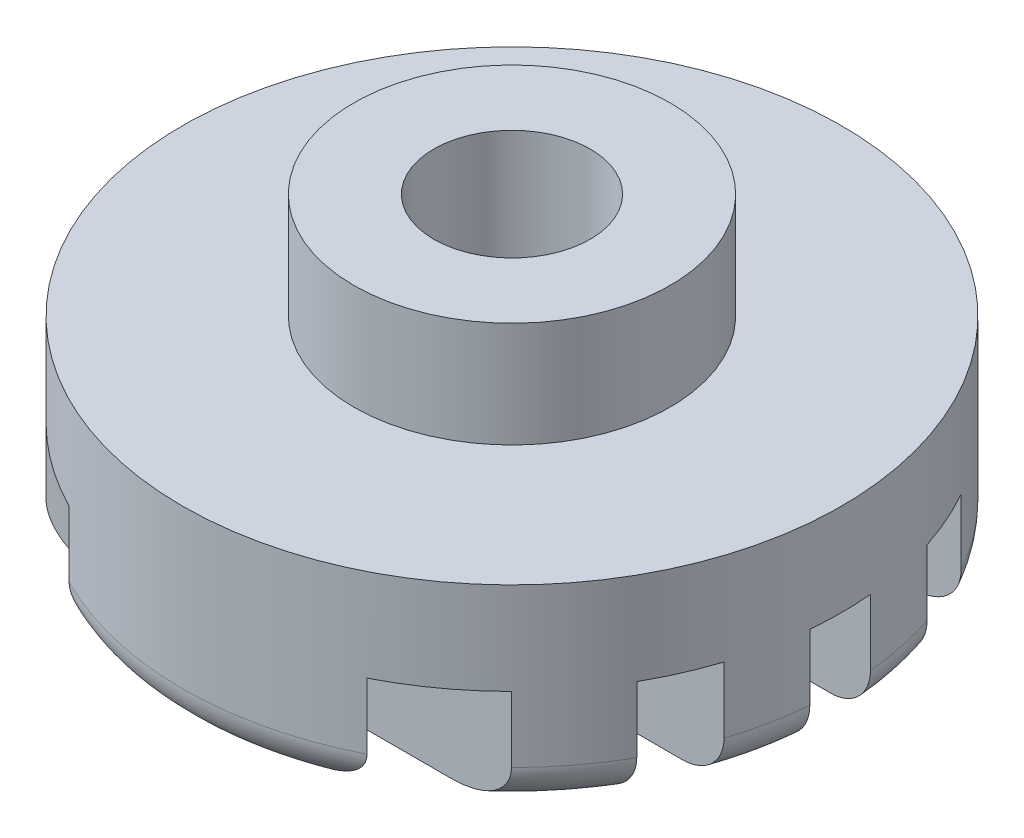
from build123d import *

# Parameters (mm, degrees)
SKETCH1_R             = 25
BOSS_EXTRUDE1_DEPTH   = 15
SKETCH14_W            = 53.859934174
SKETCH14_H            = 4.599425072
CUT_EXTRUDE13_DEPTH   = 8
LPATTERN11_COUNT      = 4
LPATTERN11_PITCH      = 10
LPATTERN11_COUNT_DIR2 = 4
LPATTERN11_PITCH_DIR2 = 10
SKETCH18_R            = 10.031636401
CUT_EXTRUDE15_DEPTH   = 8
SKETCH16_R            = 12
BOSS_EXTRUDE3_DEPTH   = 8
SKETCH19_R            = 5.934931829
CUT_EXTRUDE16_DEPTH   = 26
FILLET2_R             = 3
FILLET3_R             = 3


with BuildPart() as part:
    # Sketch1 → Boss-Extrude1 (new body)
    with BuildSketch(Plane(origin=(0, 0, 0), x_dir=(1, 0, 0), z_dir=(0, 1, 0))):
        with Locations(Location((0, 0, 0), (0, 0, 270))):
            Circle(SKETCH1_R)
    extrude(amount=BOSS_EXTRUDE1_DEPTH)

    # Sketch14 → Cut-Extrude13 (cut)
    with BuildSketch(Plane(origin=(0, 0, 0), x_dir=(1, 0, 0), z_dir=(0, 1, 0))):
        Rectangle(SKETCH14_W, SKETCH14_H)
    cut_extrude13 = extrude(amount=CUT_EXTRUDE13_DEPTH, mode=Mode.SUBTRACT)

    # LPattern11: Cut-Extrude13 4 × 4
    with Locations(*[Vector(0, 0, 1) * (i * LPATTERN11_PITCH) + Vector(0, 0, -1) * (j * LPATTERN11_PITCH_DIR2) for i in range(LPATTERN11_COUNT) for j in range(LPATTERN11_COUNT_DIR2) if (i, j) != (0, 0)]):
        add(cut_extrude13, mode=Mode.SUBTRACT)

    # Sketch18 → Cut-Extrude15 (cut)
    with BuildSketch(Plane.XZ):
        Circle(SKETCH18_R)
    extrude(amount=-CUT_EXTRUDE15_DEPTH, mode=Mode.SUBTRACT)

    # Sketch16 → Boss-Extrude3 (add)
    with BuildSketch(Plane(origin=(0, 15, 0), x_dir=(1, 0, 0), z_dir=(0, 1, 0))):
        with Locations(Location((0, 0, 0), (0, 0, 270))):
            Circle(SKETCH16_R)
    extrude(amount=BOSS_EXTRUDE3_DEPTH)

    # Sketch19 → Cut-Extrude16 (cut)
    with BuildSketch(Plane(origin=(0, 23, 0), x_dir=(1, 0, 0), z_dir=(0, 1, 0))):
        with Locations(Location((0, 0, 0), (0, 0, 270))):
            Circle(SKETCH19_R)
    extrude(amount=-CUT_EXTRUDE16_DEPTH, mode=Mode.SUBTRACT)

    # Fillet2
    # the kernel refuses this fillet: 3 mm, written as the material it takes off along each edge
    with BuildSketch(Plane(origin=(0, 0, 0), x_dir=(0, 0, 1), z_dir=(-1, 0, 0))) as fillet2_piece_1_section:
        with BuildLine():
            CenterArc((25 - FILLET2_R, FILLET2_R), FILLET2_R, 270, 90)
            Line((25 - FILLET2_R, 0), (25, 0))
            Line((25, 0), (25, FILLET2_R))
        make_face()
    fillet2_piece_1 = revolve(axis=Axis((0, 0, 0), (0, 1, 0)), revolution_arc=44.06515492, mode=Mode.PRIVATE)
    fillet2_piece_1 = split(fillet2_piece_1, bisect_by=Plane(origin=(5.02070906, 0.724658167, 17.700287464), z_dir=(0, 0, 1)), keep=Keep.TOP, mode=Mode.PRIVATE)
    add(fillet2_piece_1, mode=Mode.SUBTRACT)
    with BuildSketch(Plane(origin=(0, 0, 0), x_dir=(-0.6954759312446767, 0, 0.7185493922197345), z_dir=(-0.7185493922197345, 0, -0.6954759312446767))) as fillet2_piece_2_section:
        with BuildLine():
            CenterArc((25 - FILLET2_R, FILLET2_R), FILLET2_R, 270, 90)
            Line((25 - FILLET2_R, 0), (25, 0))
            Line((25, 0), (25, FILLET2_R))
        make_face()
    fillet2_piece_2 = revolve(axis=Axis((0, 0, 0), (0, 1, 0)), revolution_arc=44.06515492, mode=Mode.PRIVATE)
    fillet2_piece_2 = split(fillet2_piece_2, bisect_by=Plane(origin=(-5.02071043, 0.724658948, 17.700287464), z_dir=(0, 0, 1)), keep=Keep.TOP, mode=Mode.PRIVATE)
    add(fillet2_piece_2, mode=Mode.SUBTRACT)

    # Fillet3
    # the kernel refuses this fillet: 3 mm, written as the material it takes off along each edge
    with BuildSketch(Plane(origin=(0, 0, 0), x_dir=(0.6954990930978064, 0, -0.7185269733977484), z_dir=(0.7185269733977484, 0, 0.6954990930978064))) as fillet3_piece_1:
        with BuildLine():
            CenterArc((25 - FILLET3_R, FILLET3_R), FILLET3_R, 270, 90)
            Line((25 - FILLET3_R, 0), (25, 0))
            Line((25, 0), (25, FILLET3_R))
        make_face()
    revolve(axis=Axis((0, 0, 0), (0, 1, 0)), revolution_arc=88.134003662, mode=Mode.SUBTRACT)
    with BuildSketch(Plane(origin=(0, 0, 0), x_dir=(0.9771108822908511, 0, -0.21273063650728477), z_dir=(0.21273063650728477, 0, 0.9771108822908511))) as fillet3_piece_2:
        with BuildLine():
            CenterArc((25 - FILLET3_R, FILLET3_R), FILLET3_R, 270, 90)
            Line((25 - FILLET3_R, 0), (25, 0))
            Line((25, 0), (25, FILLET3_R))
        make_face()
    revolve(axis=Axis((0, 0, 0), (0, 1, 0)), revolution_arc=49.979873443, mode=Mode.SUBTRACT)
    with BuildSketch(Plane(origin=(0, 0, 0), x_dir=(-0.46542458400640074, 0, -0.8850875417733937), z_dir=(0.8850875417733937, 0, -0.46542458400640074))) as fillet3_piece_3:
        with BuildLine():
            CenterArc((25 - FILLET3_R, FILLET3_R), FILLET3_R, 270, 90)
            Line((25 - FILLET3_R, 0), (25, 0))
            Line((25, 0), (25, FILLET3_R))
        make_face()
    revolve(axis=Axis((0, 0, 0), (0, 1, 0)), revolution_arc=49.979873443, mode=Mode.SUBTRACT)
    with BuildSketch(Plane(origin=(0, 0, 0), x_dir=(0.9784698974402165, 0, 0.20638958259401557), z_dir=(-0.20638958259401557, 0, 0.9784698974402165))) as fillet3_piece_4:
        with BuildLine():
            CenterArc((25 - FILLET3_R, FILLET3_R), FILLET3_R, 270, 90)
            Line((25 - FILLET3_R, 0), (25, 0))
            Line((25, 0), (25, FILLET3_R))
        make_face()
    revolve(axis=Axis((0, 0, 0), (0, 1, 0)), revolution_arc=47.03916142, mode=Mode.SUBTRACT)
    with BuildSketch(Plane(origin=(0, 0, 0), x_dir=(-0.8178655518658356, 0, -0.5754093665132607), z_dir=(0.5754093665132607, 0, -0.8178655518658356))) as fillet3_piece_5:
        with BuildLine():
            CenterArc((25 - FILLET3_R, FILLET3_R), FILLET3_R, 270, 90)
            Line((25 - FILLET3_R, 0), (25, 0))
            Line((25, 0), (25, FILLET3_R))
        make_face()
    revolve(axis=Axis((0, 0, 0), (0, 1, 0)), revolution_arc=47.03916142, mode=Mode.SUBTRACT)
    with BuildSketch(Plane(origin=(0, 0, 0), x_dir=(0.8178655518658215, 0, 0.5754093665132807), z_dir=(-0.5754093665132807, 0, 0.8178655518658215))) as fillet3_piece_6:
        with BuildLine():
            CenterArc((25 - FILLET3_R, FILLET3_R), FILLET3_R, 270, 90)
            Line((25 - FILLET3_R, 0), (25, 0))
            Line((25, 0), (25, FILLET3_R))
        make_face()
    revolve(axis=Axis((0, 0, 0), (0, 1, 0)), revolution_arc=47.03916142, mode=Mode.SUBTRACT)
    with BuildSketch(Plane(origin=(0, 0, 0), x_dir=(-0.9784698974402178, 0, -0.20638958259400958), z_dir=(0.20638958259400958, 0, -0.9784698974402178))) as fillet3_piece_7:
        with BuildLine():
            CenterArc((25 - FILLET3_R, FILLET3_R), FILLET3_R, 270, 90)
            Line((25 - FILLET3_R, 0), (25, 0))
            Line((25, 0), (25, FILLET3_R))
        make_face()
    revolve(axis=Axis((0, 0, 0), (0, 1, 0)), revolution_arc=47.03916142, mode=Mode.SUBTRACT)
    with BuildSketch(Plane(origin=(0, 0, 0), x_dir=(0.4654245840063838, 0, 0.8850875417734027), z_dir=(-0.8850875417734027, 0, 0.4654245840063838))) as fillet3_piece_8:
        with BuildLine():
            CenterArc((25 - FILLET3_R, FILLET3_R), FILLET3_R, 270, 90)
            Line((25 - FILLET3_R, 0), (25, 0))
            Line((25, 0), (25, FILLET3_R))
        make_face()
    revolve(axis=Axis((0, 0, 0), (0, 1, 0)), revolution_arc=49.979873443, mode=Mode.SUBTRACT)
    with BuildSketch(Plane(origin=(0, 0, 0), x_dir=(-0.9771108822908537, 0, 0.2127306365072725), z_dir=(-0.2127306365072725, 0, -0.9771108822908537))) as fillet3_piece_9:
        with BuildLine():
            CenterArc((25 - FILLET3_R, FILLET3_R), FILLET3_R, 270, 90)
            Line((25 - FILLET3_R, 0), (25, 0))
            Line((25, 0), (25, FILLET3_R))
        make_face()
    revolve(axis=Axis((0, 0, 0), (0, 1, 0)), revolution_arc=49.979873443, mode=Mode.SUBTRACT)


solid = part.part
